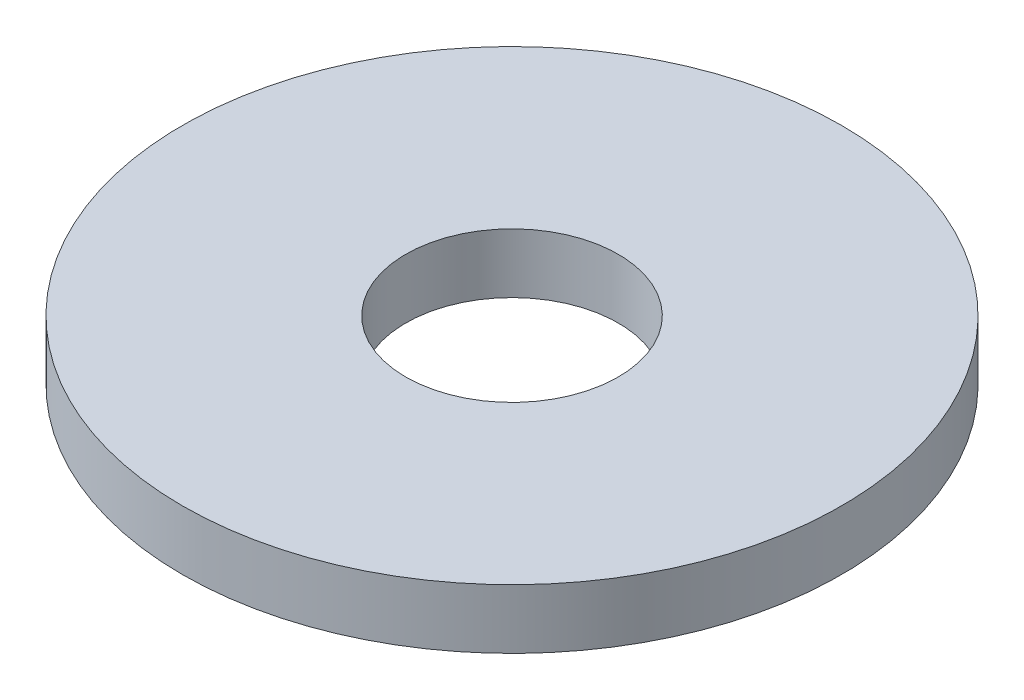
from build123d import *

# Parameters (mm, degrees)
SKETCH1_R           = 77.5
BOSS_EXTRUDE1_DEPTH = 14
SKETCH2_R           = 25
CUT_EXTRUDE1_DEPTH  = 111.492081164


with BuildPart() as part:
    # Sketch1 → Boss-Extrude1 (new body)
    with BuildSketch(Plane(origin=(0, 0, 0), x_dir=(1, 0, 0), z_dir=(0, 1, 0))):
        Circle(SKETCH1_R)
    extrude(amount=BOSS_EXTRUDE1_DEPTH)

    # Sketch2 → Cut-Extrude1 (cut, through all)
    with BuildSketch(Plane(origin=(0, 0, 0), x_dir=(1, 0, 0), z_dir=(0, 1, 0))):
        Circle(SKETCH2_R)
    extrude(amount=CUT_EXTRUDE1_DEPTH, mode=Mode.SUBTRACT)


solid = part.part
